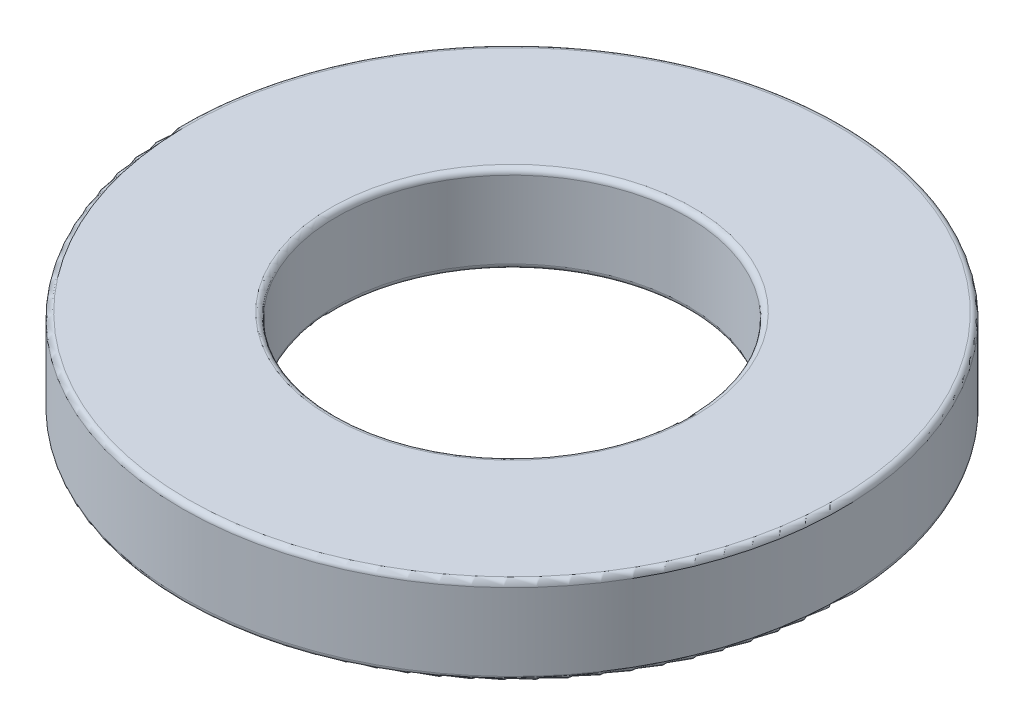
from build123d import *

# Parameters (mm, degrees)
SKETCH1_R           = 6
SKETCH1_R_2         = 3.2
BOSS_EXTRUDE1_DEPTH = 0.8
FILLET1_R           = 0.1


with BuildPart() as part:
    # Sketch1 → Boss-Extrude1 (new, symmetric)
    with BuildSketch(Plane(origin=(0, 0, 0), x_dir=(1, 0, 0), z_dir=(0, 1, 0))):
        Circle(SKETCH1_R)
        Circle(SKETCH1_R_2, mode=Mode.SUBTRACT)
    extrude(amount=BOSS_EXTRUDE1_DEPTH, both=True)

    # Fillet1
    fillet1_edges = [part.edges().sort_by_distance(p)[0] for p in [
        (-3.2, -0.8, 0),
        (-6, -0.8, 0),
        (-3.2, 0.8, 0),
        (-6, 0.8, 0),
    ]]
    fillet(fillet1_edges, radius=FILLET1_R)


solid = part.part
